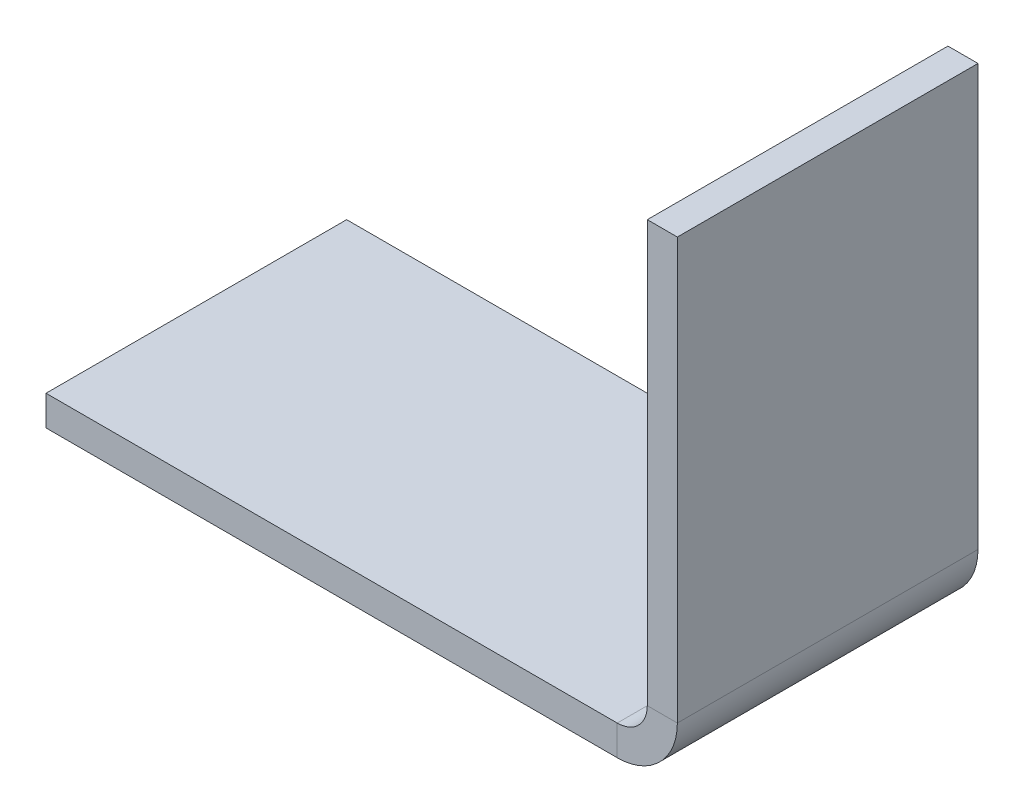
from build123d import *

# Parameters (mm, degrees)
SM_BASE_FLANGE_1_DEPTH = 10


# Sheet-metal steps are written as plain solids
with BuildPart() as part:
    # Sketch 1 → 基体-法兰1 (new body)
    with BuildSketch(Plane.XY):
        with BuildLine():
            Line((0, 0), (19, 0))
            ThreePointArc((19, 0), (19.707106781, 0.292893219), (20, 1))
            Line((20, 1), (20, 15))
            Line((20, 15), (21, 15))
            Line((21, 15), (21, 1))
            ThreePointArc((21, 1), (20.414213562, -0.414213562), (19, -1))
            Line((19, -1), (0, -1))
            Line((0, -1), (0, 0))
        make_face()
    extrude(amount=SM_BASE_FLANGE_1_DEPTH)


solid = part.part
